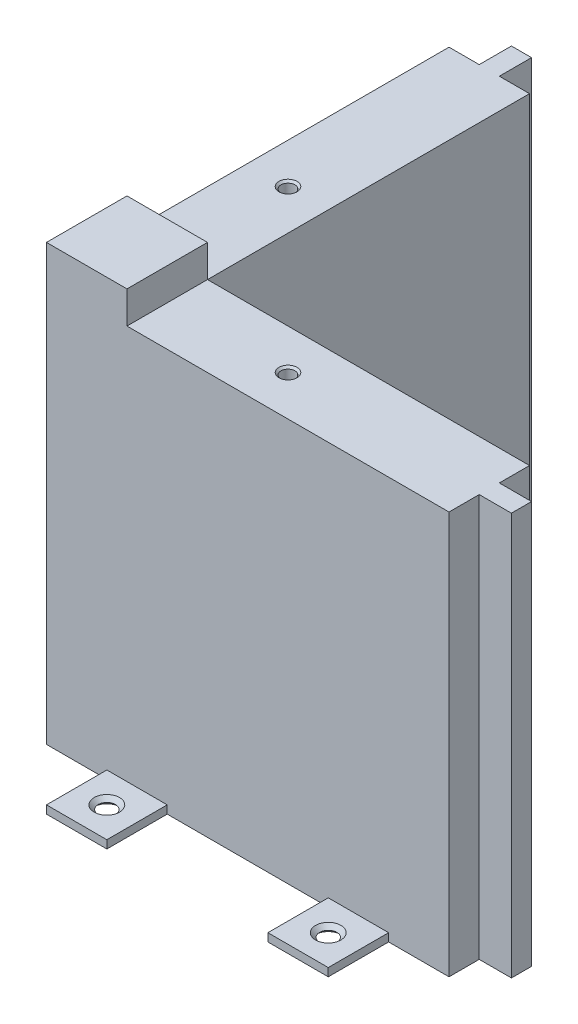
from build123d import *

# Parameters (mm, degrees)
BOSS_EXTRUDE1_DEPTH = 100
SKETCH3_W           = 20
SKETCH3_H           = 20
BOSS_EXTRUDE2_DEPTH = 8
SKETCH4_W           = 5
SKETCH4_H           = 100
BOSS_EXTRUDE3_DEPTH = 8
SKETCH5_W           = 5
SKETCH5_H           = 100
BOSS_EXTRUDE4_DEPTH = 8
SKETCH6_R           = 1.75
CUT_EXTRUDE1_DEPTH  = 8
CHAMFER1_SIZE       = 0.5
SKETCH7_W           = 15
SKETCH7_H           = 2
BOSS_EXTRUDE5_DEPTH = 15
SKETCH8_W           = 15
SKETCH8_H           = 2
BOSS_EXTRUDE6_DEPTH = 15
SKETCH9_R           = 2.15
CUT_EXTRUDE2_DEPTH  = 15
CHAMFER2_SIZE       = 1


with BuildPart() as part:
    # Sketch2 → Boss-Extrude1 (new body)
    with BuildSketch(Plane(origin=(0, 0, 0), x_dir=(1, 0, 0), z_dir=(0, 1, 0))):
        Polygon((0, 0), (0, 100), (20, 100), (20, 20), (100, 20), (100, 0), align=None)
    extrude(amount=BOSS_EXTRUDE1_DEPTH)

    # Sketch3 → Boss-Extrude2 (add)
    with BuildSketch(Plane(origin=(0, 100, 0), x_dir=(1, 0, 0), z_dir=(0, 1, 0))):
        with Locations((10, 10)):
            Rectangle(SKETCH3_W, SKETCH3_H)
    extrude(amount=BOSS_EXTRUDE2_DEPTH)

    # Sketch4 → Boss-Extrude3 (add)
    with BuildSketch(Plane(origin=(100, 0, 0), x_dir=(0, 0, -1), z_dir=(1, 0, 0))):
        with Locations((10, 50)):
            Rectangle(SKETCH4_W, SKETCH4_H)
    extrude(amount=BOSS_EXTRUDE3_DEPTH)

    # Sketch5 → Boss-Extrude4 (add)
    with BuildSketch(Plane(origin=(0, 0, -100), x_dir=(-1, 0, 0), z_dir=(0, 0, -1))):
        with Locations((-10, 50)):
            Rectangle(SKETCH5_W, SKETCH5_H)
    extrude(amount=BOSS_EXTRUDE4_DEPTH)

    # Sketch6 → Cut-Extrude1 (cut)
    with BuildSketch(Plane(origin=(0, 100, 0), x_dir=(1, 0, 0), z_dir=(0, 1, 0))):
        with Locations(Location((50, 10, 0), (0, 0, 270))):
            Circle(SKETCH6_R)
        with Locations(Location((10, 50, 0), (0, 0, 270))):
            Circle(SKETCH6_R)
    extrude(amount=-CUT_EXTRUDE1_DEPTH, mode=Mode.SUBTRACT)

    # Chamfer1
    chamfer1_edges = [part.edges().sort_by_distance(p)[0] for p in [
        (50, 100, -11.75),
        (10, 100, -51.75),
    ]]
    chamfer(chamfer1_edges, length=CHAMFER1_SIZE)

    # Sketch7 → Boss-Extrude5 (add)
    with BuildSketch(Plane.XY):
        with Locations((22.5, 1)):
            Rectangle(SKETCH7_W, SKETCH7_H)
        with Locations((77.5, 1)):
            Rectangle(SKETCH7_W, SKETCH7_H)
    extrude(amount=BOSS_EXTRUDE5_DEPTH)

    # Sketch8 → Boss-Extrude6 (add)
    with BuildSketch(Plane.ZY):
        with Locations((-77.5, 1)):
            Rectangle(SKETCH8_W, SKETCH8_H)
        with Locations((-22.5, 1)):
            Rectangle(SKETCH8_W, SKETCH8_H)
    extrude(amount=BOSS_EXTRUDE6_DEPTH)

    # Sketch9 → Cut-Extrude2 (cut)
    with BuildSketch(Plane(origin=(0, 2, 0), x_dir=(1, 0, 0), z_dir=(0, 1, 0))):
        with Locations(Location((-7.5, 77.5, 0), (0, 0, 270))):
            Circle(SKETCH9_R)
        with Locations(Location((-7.5, 22.5, 0), (0, 0, 270))):
            Circle(SKETCH9_R)
        with Locations(Location((22.5, -7.5, 0), (0, 0, 270))):
            Circle(SKETCH9_R)
        with Locations(Location((77.5, -7.5, 0), (0, 0, 270))):
            Circle(SKETCH9_R)
    extrude(amount=-CUT_EXTRUDE2_DEPTH, mode=Mode.SUBTRACT)

    # Chamfer2
    chamfer2_edges = [part.edges().sort_by_distance(p)[0] for p in [
        (-7.5, 0, -79.65),
        (-7.5, 2, -79.65),
        (-7.5, 2, -24.65),
        (22.5, 0, 5.35),
        (22.5, 2, 5.35),
        (77.5, 0, 5.35),
        (77.5, 2, 5.35),
    ]]
    chamfer(chamfer2_edges, length=CHAMFER2_SIZE - 0.0001)  # a hair under: the kernel refuses the full size


solid = part.part
